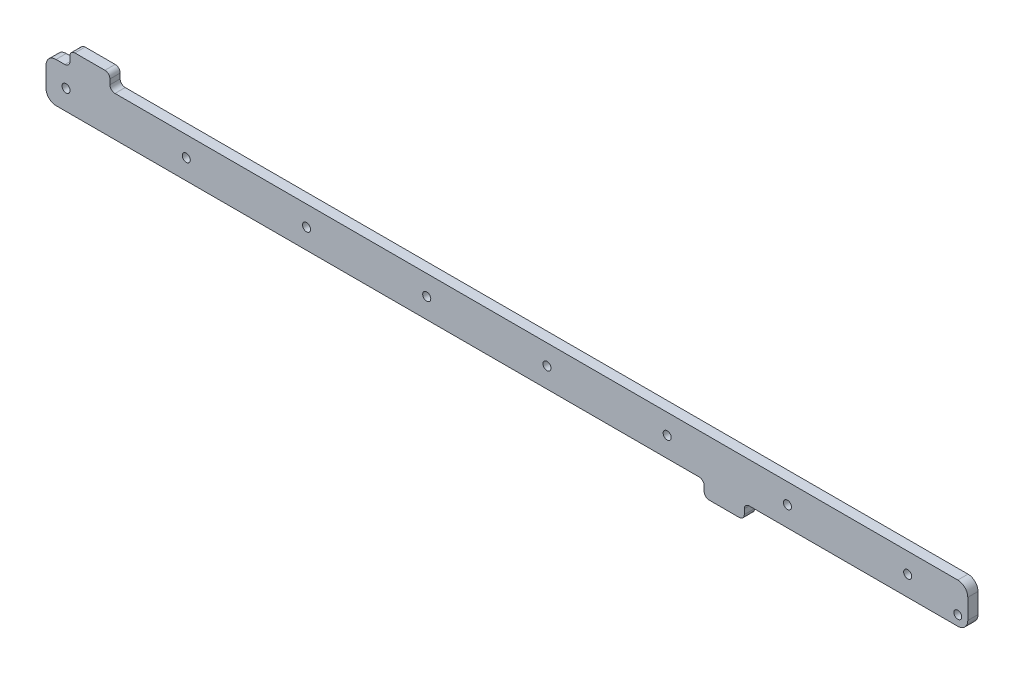
from build123d import *

# Parameters (mm, degrees)
SKETCH1_R                                          = 2.4892
BOSS_EXTRUDE1_DEPTH                                = 6.477
FILLET2_R                                          = 6.35
CSK_FOR_10_FLAT_HEAD_MACHINE_SCREW_100_D           = 5.1054
CSK_FOR_10_FLAT_HEAD_MACHINE_SCREW_100_CSINK_D     = 9.779
CSK_FOR_10_FLAT_HEAD_MACHINE_SCREW_100_CSINK_ANGLE = 100
LPATTERN1_COUNT                                    = 8
LPATTERN1_PITCH                                    = 76.2
FILLET3_R                                          = 3.175


with BuildPart() as part:
    # Sketch1 → Boss-Extrude1 (new body)
    with BuildSketch(Plane.XY):
        Polygon((0, 25.4), (0, 0), (40.53078, 0), (417.140898, 0), (417.140898, -9.525), (442.540898, -9.525), (442.540898, 0), (584.2, 0), (584.2, 25.4), (40.53078, 25.4), (40.53078, 34.925), (15.13078, 34.925), (15.13078, 25.4), align=None)
        with Locations((577.85, 6.35)):
            Circle(SKETCH1_R, mode=Mode.SUBTRACT)
    extrude(amount=BOSS_EXTRUDE1_DEPTH)

    # Fillet2
    fillet2_edges = [part.edges().sort_by_distance(p)[0] for p in [
        (0, 0, 3.2385),
        (0, 25.4, 3.2385),
        (584.2, 25.4, 3.2385),
        (584.2, 0, 3.2385),
    ]]
    fillet(fillet2_edges, radius=FILLET2_R)

    # CSK for #10 Flat Head Machine Screw (100)1 (through all)
    with Locations(Plane.XY.offset(6.477)):
        with Locations((546.1, 12.7)):
            csk_for_10_flat_head_machine_screw_100 = CounterSinkHole(CSK_FOR_10_FLAT_HEAD_MACHINE_SCREW_100_D / 2, CSK_FOR_10_FLAT_HEAD_MACHINE_SCREW_100_CSINK_D / 2, counter_sink_angle=CSK_FOR_10_FLAT_HEAD_MACHINE_SCREW_100_CSINK_ANGLE)

    # LPattern1: CSK for #10 Flat Head Machine Screw (100)1 ×8
    with Locations(*[(-i * LPATTERN1_PITCH, 0, 0) for i in range(1, LPATTERN1_COUNT)]):
        add(csk_for_10_flat_head_machine_screw_100, mode=Mode.SUBTRACT)


with BuildPart() as body_2:
    # Mirror2: mirrored copy
    add(part.part.mirror(Plane.XY))

    # Fillet3
    fillet3_edges = [body_2.edges().sort_by_distance(p)[0] for p in [
        (442.540898, 0, -3.2385),
        (442.540898, -9.525, -3.2385),
        (417.140898, -9.525, -3.2385),
        (417.140898, 0, -3.2385),
        (40.53078, 25.4, -3.2385),
        (40.53078, 34.925, -3.2385),
        (15.13078, 34.925, -3.2385),
        (15.13078, 25.4, -3.2385),
    ]]
    fillet(fillet3_edges, radius=FILLET3_R)


solid = body_2.part
